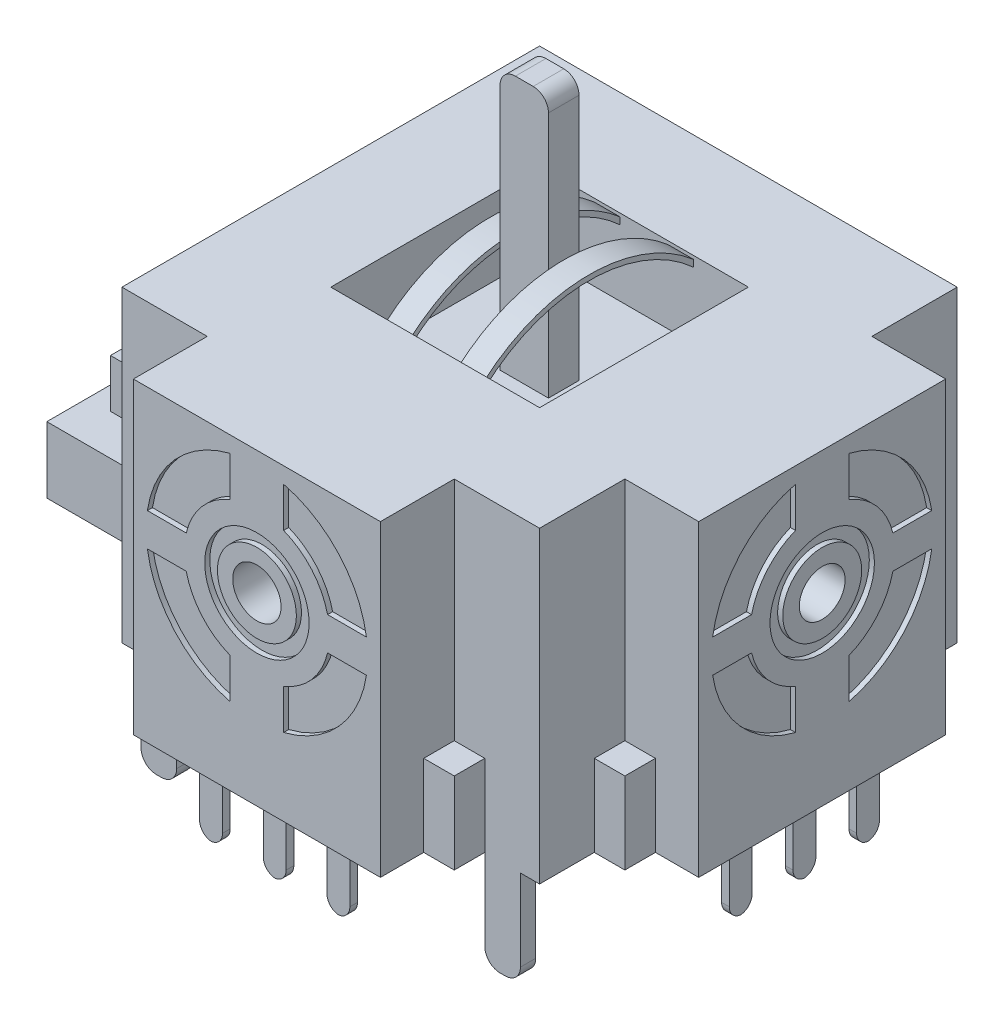
from build123d import *

# Parameters (mm, degrees)
SKETCH_1_W          = 16.4
SKETCH_1_H          = 16.4
SKETCH_1_W_2        = 2.9
SKETCH_1_H_2        = 9.7
SKETCH_1_W_3        = 9.7
SKETCH_1_H_3        = 2.9
EXTRUDE_1_DEPTH     = 12.1
EXTRUDE_START       = -12.1
SKETCH_1_3_W        = 5.5
SKETCH_1_3_H        = 6.3
EXTRUDE_2_DEPTH     = 2.6
SKETCH_1_4_W        = 5.5
SKETCH_1_4_H        = 6.3
EXTRUDE_3_DEPTH     = 4.5
EXTRUDE_START_2     = -4.5
SKETCH_2_R          = 1.75
EXTRUDE_4_DEPTH     = 5.9
SKETCH_2_3_R        = 0.65
EXTRUDE_5_DEPTH     = 0.2
SKETCH_3_W          = 1.2
SKETCH_3_H          = 1.2
EXTRUDE_6_DEPTH     = 3.2
SKETCH_5_W          = 1.4
SKETCH_5_H          = 0.6
EXTRUDE_7_DEPTH     = 3.8
SKETCH_5_3_W        = 0.9
SKETCH_5_3_H        = 0.3
SKETCH_5_3_W_2      = 0.3
SKETCH_5_3_H_2      = 0.9
EXTRUDE_8_DEPTH     = 2.8
SKETCH_4_R          = 2.05
SKETCH_4_R_2        = 1.55
CUT_EXTRUDE_1_DEPTH = 0.2
SKETCH_4_3_R        = 0.95
CUT_EXTRUDE_2_DEPTH = 30.769447425
SKETCH_6_R          = 2.05
SKETCH_6_R_2        = 1.55
CUT_EXTRUDE_3_DEPTH = 0.2
SKETCH_6_3_R        = 0.9
CUT_EXTRUDE_4_DEPTH = 33.194875369
SKETCH_7_R          = 1.3
EXTRUDE_9_DEPTH     = 3.5
SKETCH_8_W          = 8.2
SKETCH_8_H          = 8.2
SKETCH_8_W_2        = 1.9
SKETCH_8_H_2        = 1.2
CUT_EXTRUDE_5_DEPTH = 3
SKETCH_8_2_W        = 1.9
SKETCH_8_2_H        = 1.2
EXTRUDE_10_DEPTH    = 7.3
EXTRUDE_START_3     = 0.95
SKETCH_9_R          = 6.25
SKETCH_9_R_2        = 6.05
EXTRUDE_2_2_DEPTH   = 1
EXTRUDE_START_4     = -1.95
SKETCH_9_3_R        = 6.25
SKETCH_9_3_R_2      = 6.05
EXTRUDE_3_2_DEPTH   = 1
FILLET_1_R          = 0.5
FILLET_2_R          = 0.6
FILLET_3_R          = 0.6


with BuildPart() as part:
    # 草图1 → 凸台-拉伸1 (new body)
    with BuildSketch(Plane(origin=(0, 0, 0), x_dir=(1, 0, 0), z_dir=(0, 1, 0))):
        Rectangle(SKETCH_1_W, SKETCH_1_H)
        with Locations((9.65, 0)):
            Rectangle(SKETCH_1_W_2, SKETCH_1_H_2)
        with Locations((0, -9.65)):
            Rectangle(SKETCH_1_W_3, SKETCH_1_H_3)
    extrude(amount=-EXTRUDE_1_DEPTH)

    # 草图1<3> → Extrude 2 (add)
    with BuildSketch(Plane(origin=(0, 0, 0), x_dir=(1, 0, 0), z_dir=(0, 1, 0)).offset(EXTRUDE_START)):
        Polygon((-13.7, -3.15), (-8.2, -4.75), (-14.6, -4.75), (-14.6, 4.75), (-8.2, 4.75), (-13.7, 3.15), align=None)
        Polygon((-8.2, 3.15), (-8.2, 4.75), (-13.7, 3.15), align=None)
        with Locations((-10.95, 0)):
            Rectangle(SKETCH_1_3_W, SKETCH_1_3_H)
        Polygon((-8.2, -4.75), (-8.2, -3.15), (-13.7, -3.15), align=None)
    extrude(amount=EXTRUDE_2_DEPTH)

    # 草图1<4> → Extrude 3 (add)
    with BuildSketch(Plane(origin=(0, 0, 0), x_dir=(1, 0, 0), z_dir=(0, 1, 0)).offset(EXTRUDE_START)):
        with Locations((-10.95, 0)):
            Rectangle(SKETCH_1_4_W, SKETCH_1_4_H)
    extrude(amount=EXTRUDE_3_DEPTH)

    # 草图2 → 凸台-拉伸4 (add)
    with BuildSketch(Plane(origin=(0, -7.6, 0), x_dir=(1, 0, 0), z_dir=(0, 1, 0)).offset(EXTRUDE_START_2)):
        with Locations(Location((-10.95, 0, 0), (0, 0, 270))):
            Circle(SKETCH_2_R)
    extrude(amount=EXTRUDE_4_DEPTH)

    # 草图2<3> → 凸台-拉伸5 (add)
    with BuildSketch(Plane(origin=(0, -7.6, 0), x_dir=(1, 0, 0), z_dir=(0, 1, 0))):
        with Locations(Location((-12.9, 2, 0), (0, 0, 270))):
            Circle(SKETCH_2_3_R)
        with Locations(Location((-12.9, -2, 0), (0, 0, 270))):
            Circle(SKETCH_2_3_R)
    extrude(amount=EXTRUDE_5_DEPTH)

    # 草图3 → 凸台-拉伸6 (add)
    with BuildSketch(Plane.XZ.offset(12.1)):
        with Locations((-5.45, 8.8)):
            Rectangle(SKETCH_3_W, SKETCH_3_H)
        with Locations((5.45, 8.8)):
            Rectangle(SKETCH_3_W, SKETCH_3_H)
        with Locations((8.8, 5.45)):
            Rectangle(SKETCH_3_W, SKETCH_3_H)
        with Locations((8.8, -5.45)):
            Rectangle(SKETCH_3_W, SKETCH_3_H)
        with Locations((5.45, -8.8)):
            Rectangle(SKETCH_3_W, SKETCH_3_H)
        with Locations((-5.45, -8.8)):
            Rectangle(SKETCH_3_W, SKETCH_3_H)
        with Locations((-8.8, 5.35)):
            Rectangle(SKETCH_3_W, SKETCH_3_H)
        with Locations((-8.8, -5.35)):
            Rectangle(SKETCH_3_W, SKETCH_3_H)
    extrude(amount=-EXTRUDE_6_DEPTH)

    # 草图5 → 凸台-拉伸7 (add)
    with BuildSketch(Plane.XZ.offset(12.1)):
        with Locations((-6.75, 7.9)):
            Rectangle(SKETCH_5_W, SKETCH_5_H)
        with Locations((6.75, 7.9)):
            Rectangle(SKETCH_5_W, SKETCH_5_H)
        with Locations((6.75, -7.9)):
            Rectangle(SKETCH_5_W, SKETCH_5_H)
        with Locations((-6.75, -7.9)):
            Rectangle(SKETCH_5_W, SKETCH_5_H)
    extrude(amount=EXTRUDE_7_DEPTH)

    # 草图5<3> → 凸台-拉伸8 (add)
    with BuildSketch(Plane.XZ.offset(12.1)):
        with Locations((-2.5, 10.25)):
            Rectangle(SKETCH_5_3_W, SKETCH_5_3_H)
        with Locations((2.5, 10.25)):
            Rectangle(SKETCH_5_3_W, SKETCH_5_3_H)
        with Locations((10.25, -2.5)):
            Rectangle(SKETCH_5_3_W_2, SKETCH_5_3_H_2)
        with Locations((10.25, 2.5)):
            Rectangle(SKETCH_5_3_W_2, SKETCH_5_3_H_2)
        with Locations((-12.65, 3.1)):
            Rectangle(SKETCH_5_3_W, SKETCH_5_3_H)
        with Locations((-12.65, -3.1)):
            Rectangle(SKETCH_5_3_W, SKETCH_5_3_H)
        with Locations((-7.65, -3.1)):
            Rectangle(SKETCH_5_3_W, SKETCH_5_3_H)
        with Locations((-7.65, 3.1)):
            Rectangle(SKETCH_5_3_W, SKETCH_5_3_H)
        with Locations((0, 10.25)):
            Rectangle(SKETCH_5_3_W, SKETCH_5_3_H)
        with Locations((10.25, 0)):
            Rectangle(SKETCH_5_3_W_2, SKETCH_5_3_H_2)
    extrude(amount=EXTRUDE_8_DEPTH)

    # 草图4 → 切除-拉伸1 (cut)
    # profile 1 of 5: a face of its own
    with BuildSketch(Plane.XY.offset(11.1)):
        with BuildLine():
            ThreePointArc((-4.301162634, -5.5), (-3.216739618, -7.778324816), (-1.05, -9.071374184))
            Line((-1.05, -9.071374184), (-1.05, -7.49952826))
            ThreePointArc((-1.05, -7.49952826), (-2.158001203, -6.71159362), (-2.774887385, -5.5))
            Line((-2.774887385, -5.5), (-4.301162634, -5.5))
        make_face()
    # profile 2 of 5: a face of its own
    with BuildSketch(Plane.XY.offset(11.1)):
        with BuildLine():
            Line((1.05, -7.49952826), (1.05, -9.071374184))
            ThreePointArc((1.05, -9.071374184), (3.216739618, -7.778324816), (4.301162634, -5.5))
            Line((4.301162634, -5.5), (2.774887385, -5.5))
            ThreePointArc((2.774887385, -5.5), (2.158001203, -6.71159362), (1.05, -7.49952826))
        make_face()
    # profile 3 of 5: a face of its own
    with BuildSketch(Plane.XY.offset(11.1)):
        with Locations((0, -4.85)):
            Circle(SKETCH_4_R)
        with Locations((0, -4.85)):
            Circle(SKETCH_4_R_2, mode=Mode.SUBTRACT)
    # profile 4 of 5: a face of its own
    with BuildSketch(Plane.XY.offset(11.1)):
        with BuildLine():
            ThreePointArc((-1.05, -0.628625816), (-3.216739618, -1.921675184), (-4.301162634, -4.2))
            Line((-4.301162634, -4.2), (-2.774887385, -4.2))
            ThreePointArc((-2.774887385, -4.2), (-2.158001203, -2.98840638), (-1.05, -2.20047174))
            Line((-1.05, -2.20047174), (-1.05, -0.628625816))
        make_face()
    # profile 5 of 5: a face of its own
    with BuildSketch(Plane.XY.offset(11.1)):
        with BuildLine():
            Line((2.774887385, -4.2), (4.301162634, -4.2))
            ThreePointArc((4.301162634, -4.2), (3.216739618, -1.921675184), (1.05, -0.628625816))
            Line((1.05, -0.628625816), (1.05, -2.20047174))
            ThreePointArc((1.05, -2.20047174), (2.158001203, -2.98840638), (2.774887385, -4.2))
        make_face()
    extrude(amount=-CUT_EXTRUDE_1_DEPTH, mode=Mode.SUBTRACT)

    # 草图4<3> → 切除-拉伸2 (cut, through all)
    with BuildSketch(Plane.XY.offset(11.1)):
        with Locations((0, -4.85)):
            Circle(SKETCH_4_3_R)
    extrude(amount=-CUT_EXTRUDE_2_DEPTH, mode=Mode.SUBTRACT)

    # 草图6 → 切除-拉伸3 (cut)
    # profile 1 of 5: a face of its own
    with BuildSketch(Plane(origin=(11.1, 0, 0), x_dir=(0, 0, -1), z_dir=(1, 0, 0))):
        with BuildLine():
            ThreePointArc((-4.301162634, -5.5), (-3.216739618, -7.778324816), (-1.05, -9.071374184))
            Line((-1.05, -9.071374184), (-1.05, -7.49952826))
            ThreePointArc((-1.05, -7.49952826), (-2.158001203, -6.71159362), (-2.774887385, -5.5))
            Line((-2.774887385, -5.5), (-4.301162634, -5.5))
        make_face()
    # profile 2 of 5: a face of its own
    with BuildSketch(Plane(origin=(11.1, 0, 0), x_dir=(0, 0, -1), z_dir=(1, 0, 0))):
        with BuildLine():
            Line((1.05, -7.49952826), (1.05, -9.071374184))
            ThreePointArc((1.05, -9.071374184), (3.216739618, -7.778324816), (4.301162634, -5.5))
            Line((4.301162634, -5.5), (2.774887385, -5.5))
            ThreePointArc((2.774887385, -5.5), (2.158001203, -6.71159362), (1.05, -7.49952826))
        make_face()
    # profile 3 of 5: a face of its own
    with BuildSketch(Plane(origin=(11.1, 0, 0), x_dir=(0, 0, -1), z_dir=(1, 0, 0))):
        with Locations((0, -4.85)):
            Circle(SKETCH_6_R)
        with Locations((0, -4.85)):
            Circle(SKETCH_6_R_2, mode=Mode.SUBTRACT)
    # profile 4 of 5: a face of its own
    with BuildSketch(Plane(origin=(11.1, 0, 0), x_dir=(0, 0, -1), z_dir=(1, 0, 0))):
        with BuildLine():
            ThreePointArc((-1.05, -0.628625816), (-3.216739618, -1.921675184), (-4.301162634, -4.2))
            Line((-4.301162634, -4.2), (-2.774887385, -4.2))
            ThreePointArc((-2.774887385, -4.2), (-2.158001203, -2.98840638), (-1.05, -2.20047174))
            Line((-1.05, -2.20047174), (-1.05, -0.628625816))
        make_face()
    # profile 5 of 5: a face of its own
    with BuildSketch(Plane(origin=(11.1, 0, 0), x_dir=(0, 0, -1), z_dir=(1, 0, 0))):
        with BuildLine():
            Line((2.774887385, -4.2), (4.301162634, -4.2))
            ThreePointArc((4.301162634, -4.2), (3.216739618, -1.921675184), (1.05, -0.628625816))
            Line((1.05, -0.628625816), (1.05, -2.20047174))
            ThreePointArc((1.05, -2.20047174), (2.158001203, -2.98840638), (2.774887385, -4.2))
        make_face()
    extrude(amount=-CUT_EXTRUDE_3_DEPTH, mode=Mode.SUBTRACT)

    # 草图6<3> → 切除-拉伸4 (cut, through all)
    with BuildSketch(Plane(origin=(11.1, 0, 0), x_dir=(0, 0, -1), z_dir=(1, 0, 0))):
        with Locations((0, -4.85)):
            Circle(SKETCH_6_3_R)
    extrude(amount=-CUT_EXTRUDE_4_DEPTH, mode=Mode.SUBTRACT)

    # 草图7 → 凸台-拉伸9 (add)
    with BuildSketch(Plane.ZY.offset(8.2)):
        with Locations(Location((0, -4.85, 0), (0, 0, 180))):
            Circle(SKETCH_7_R)
    extrude(amount=EXTRUDE_9_DEPTH)

    # 草图8 → 切除-拉伸5 (cut)
    with BuildSketch(Plane(origin=(0, 0, 0), x_dir=(1, 0, 0), z_dir=(0, 1, 0))):
        Rectangle(SKETCH_8_W, SKETCH_8_H)
        Rectangle(SKETCH_8_W_2, SKETCH_8_H_2, mode=Mode.SUBTRACT)
    extrude(amount=-CUT_EXTRUDE_5_DEPTH, mode=Mode.SUBTRACT)

    # 草图8<2> → 凸台-拉伸10 (add)
    with BuildSketch(Plane(origin=(0, 0, 0), x_dir=(1, 0, 0), z_dir=(0, 1, 0))):
        Rectangle(SKETCH_8_2_W, SKETCH_8_2_H)
    extrude(amount=EXTRUDE_10_DEPTH)

    # 草图9 → Extrude 2 2 (add)
    with BuildSketch(Plane(origin=(0, 0, 0), x_dir=(0, 0, -1), z_dir=(1, 0, 0)).offset(EXTRUDE_START_3)):
        with Locations((0, -4.85)):
            Circle(SKETCH_9_R)
        with Locations((0, -4.85)):
            Circle(SKETCH_9_R_2, mode=Mode.SUBTRACT)
    extrude(amount=EXTRUDE_2_2_DEPTH)

    # 草图9<3> → Extrude 3 2 (add)
    with BuildSketch(Plane(origin=(0, 0, 0), x_dir=(0, 0, -1), z_dir=(1, 0, 0)).offset(EXTRUDE_START_4)):
        with Locations((0, -4.85)):
            Circle(SKETCH_9_3_R)
        with Locations((0, -4.85)):
            Circle(SKETCH_9_3_R_2, mode=Mode.SUBTRACT)
    extrude(amount=EXTRUDE_3_2_DEPTH)

    # 圆角1
    # the kernel refuses this fillet: 0.5 mm, written as the material it takes off along each edge
    with BuildSketch(Plane(origin=(-13.1, -14.9, -1.7), x_dir=(0, 1, 0), z_dir=(0, 0, -1)), Plane(origin=(-12.2, -14.9, -4.5), x_dir=(0, 1, 0), z_dir=(0, 0, 1)), Plane(origin=(-8.1, -14.9, -1.7), x_dir=(0, 1, 0), z_dir=(0, 0, -1)), Plane(origin=(-7.2, -14.9, -4.5), x_dir=(0, 1, 0), z_dir=(0, 0, 1)), Plane(origin=(-13.1, -14.9, 4.5), x_dir=(0, 1, 0), z_dir=(0, 0, -1)), Plane(origin=(-12.2, -14.9, 1.7), x_dir=(0, 1, 0), z_dir=(0, 0, 1)), Plane(origin=(-8.1, -14.9, 4.5), x_dir=(0, 1, 0), z_dir=(0, 0, -1)), Plane(origin=(-7.2, -14.9, 1.7), x_dir=(0, 1, 0), z_dir=(0, 0, 1)), Plane(origin=(11.65, -14.9, 2.95), x_dir=(0, 1, 0), z_dir=(-1, 0, 0)), Plane(origin=(8.85, -14.9, 2.05), x_dir=(0, 1, 0), z_dir=(1, 0, 0)), Plane(origin=(8.85, -14.9, -2.95), x_dir=(0, 1, 0), z_dir=(1, 0, 0)), Plane(origin=(11.65, -14.9, -2.05), x_dir=(0, 1, 0), z_dir=(-1, 0, 0)), Plane(origin=(8.85, -14.9, -0.45), x_dir=(0, 1, 0), z_dir=(1, 0, 0)), Plane(origin=(11.65, -14.9, 0.45), x_dir=(0, 1, 0), z_dir=(-1, 0, 0))) as fillet_1_piece_1:
        with BuildLine():
            CenterArc((FILLET_1_R, FILLET_1_R), FILLET_1_R, 180, 90)
            Line((0, FILLET_1_R), (0, 0))
            Line((0, 0), (FILLET_1_R, 0))
        make_face()
    extrude(amount=2.8, mode=Mode.SUBTRACT)
    with BuildSketch(Plane(origin=(-2.95, -14.9, 8.85), x_dir=(0, 1, 0), z_dir=(0, 0, 1)), Plane(origin=(-2.05, -14.9, 11.65), x_dir=(0, 1, 0), z_dir=(0, 0, -1)), Plane(origin=(-0.45, -14.9, 8.85), x_dir=(0, 1, 0), z_dir=(0, 0, 1)), Plane(origin=(0.45, -14.9, 11.65), x_dir=(0, 1, 0), z_dir=(0, 0, -1)), Plane(origin=(2.05, -14.9, 8.85), x_dir=(0, 1, 0), z_dir=(0, 0, 1)), Plane(origin=(2.95, -14.9, 11.65), x_dir=(0, 1, 0), z_dir=(0, 0, -1))) as fillet_1_piece_2:
        with BuildLine():
            CenterArc((FILLET_1_R, -FILLET_1_R), FILLET_1_R, 90, 90)
            Line((0, -FILLET_1_R), (0, 0))
            Line((0, 0), (FILLET_1_R, 0))
        make_face()
    extrude(amount=2.8, mode=Mode.SUBTRACT)

    # 圆角2
    fillet_2_edges = [part.edges().sort_by_distance(p)[0] for p in [
        (-6.05, -15.9, 7.9),
        (-7.45, -15.9, 7.9),
        (-7.45, -15.9, -7.9),
        (-6.05, -15.9, -7.9),
        (6.05, -15.9, -7.9),
        (7.45, -15.9, -7.9),
        (7.45, -15.9, 7.9),
        (6.05, -15.9, 7.9),
    ]]
    fillet(fillet_2_edges, radius=FILLET_2_R)

    # 圆角3
    fillet_3_edges = [part.edges().sort_by_distance(p)[0] for p in [
        (-0.95, 7.3, 0),
        (0.95, 7.3, 0),
    ]]
    fillet(fillet_3_edges, radius=FILLET_3_R)


solid = part.part
